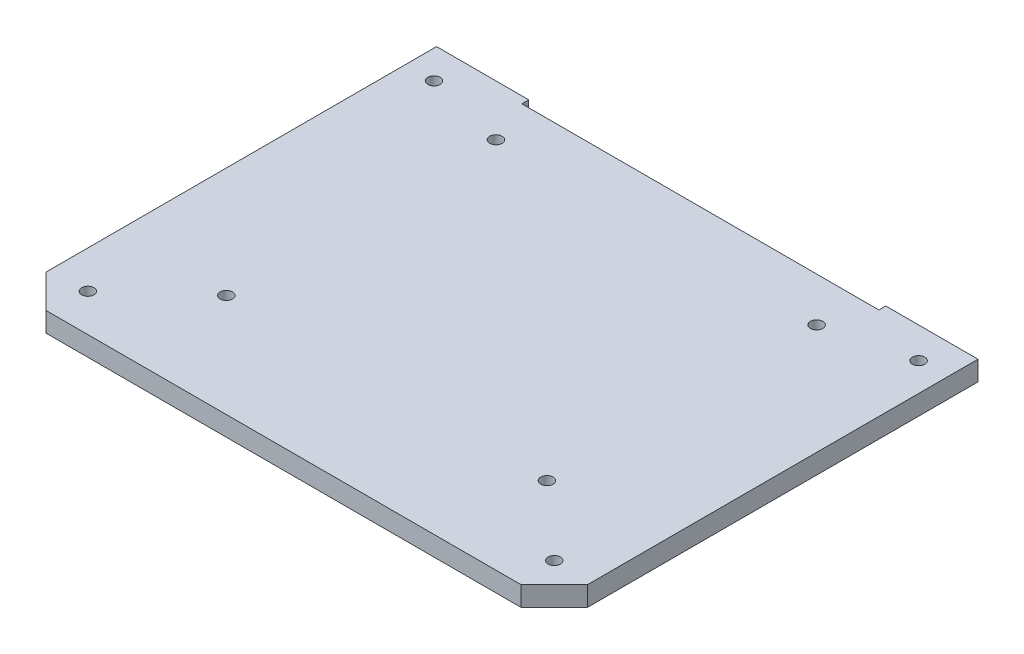
from build123d import *

# Parameters (mm, degrees)
LID_PLATE_DEPTH     = 2.4
DRIP_SKIRT_DEPTH    = 3.01
SKETCH3_W           = 25.3
SKETCH3_H           = 1.9
FRONT_SKIRT_L_DEPTH = 5.4
SKETCH4_W           = 25.3
SKETCH4_H           = 1.9
FRONT_SKIRT_R_DEPTH = 5.4
SKETCH5_R           = 1.7
SCREW_HOLES_DEPTH   = 4.4


with BuildPart() as part:
    # Sketch1 → Lid Plate (new body)
    with BuildSketch(Plane(origin=(0, 26, 0), x_dir=(1, 0, 0), z_dir=(0, 1, 0))):
        Polygon((-65.187005769, -126.3), (65.187005769, -126.3), (74.3, -117.187005769), (74.3, -11.9), (-74.3, -11.9), (-74.3, -117.187005769), align=None)
    extrude(amount=LID_PLATE_DEPTH)

    # Sketch2 → Drip Skirt (add)
    with BuildSketch(Plane(origin=(0, 23, 0), x_dir=(1, 0, 0), z_dir=(0, 1, 0))):
        Polygon((74.3, -11.9), (74.3, -117.187005769), (65.187005769, -126.3), (-65.187005769, -126.3), (-74.3, -117.187005769), (-74.3, -11.9), (-72.7, -11.9), (-72.7, -116.524264069), (-64.524264069, -124.7), (64.524264069, -124.7), (72.7, -116.524264069), (72.7, -11.9), align=None)
    extrude(amount=DRIP_SKIRT_DEPTH)

    # Sketch3 → Front Skirt L (add)
    with BuildSketch(Plane(origin=(0, 23, 0), x_dir=(1, 0, 0), z_dir=(0, 1, 0))):
        with Locations((-61.65, -10.95)):
            Rectangle(SKETCH3_W, SKETCH3_H)
    extrude(amount=FRONT_SKIRT_L_DEPTH)

    # Sketch4 → Front Skirt R (add)
    with BuildSketch(Plane(origin=(0, 23, 0), x_dir=(1, 0, 0), z_dir=(0, 1, 0))):
        with Locations((61.65, -10.95)):
            Rectangle(SKETCH4_W, SKETCH4_H)
    extrude(amount=FRONT_SKIRT_R_DEPTH)

    # Sketch5 → Screw Holes (cut)
    with BuildSketch(Plane(origin=(0, 25, 0), x_dir=(1, 0, 0), z_dir=(0, 1, 0))):
        with Locations((-66.5, -18.5)):
            Circle(SKETCH5_R)
        with Locations((66.5, -18.5)):
            Circle(SKETCH5_R)
        with Locations((-64, -116)):
            Circle(SKETCH5_R)
        with Locations((64, -116)):
            Circle(SKETCH5_R)
        with Locations((-44, -24)):
            Circle(SKETCH5_R)
        with Locations((-44, -98)):
            Circle(SKETCH5_R)
        with Locations((44, -24)):
            Circle(SKETCH5_R)
        with Locations((44, -98)):
            Circle(SKETCH5_R)
    extrude(amount=SCREW_HOLES_DEPTH, mode=Mode.SUBTRACT)


solid = part.part
